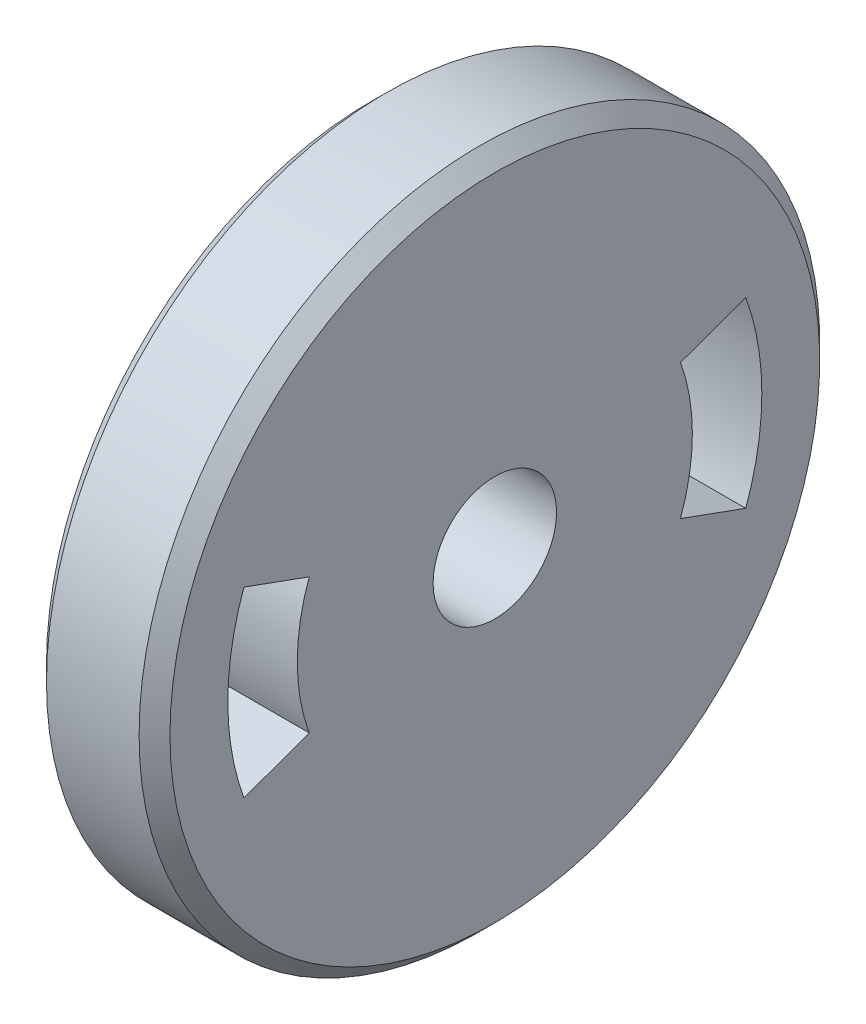
from build123d import *

# Parameters (mm, degrees)
SKETCH1_R           = 22.05
BOSS_EXTRUDE1_DEPTH = 8
CUT_EXTRUDE1_REACH  = 54.573
SKETCH2_R           = 4
CUT_EXTRUDE2_REACH  = 54.573
FILLET1_SIZE        = 1
BOSS_EXTRUDE2_START = 6
SKETCH4_W           = 14
SKETCH4_H           = 20
SKETCH4_R           = 4
BOSS_EXTRUDE2_DEPTH = 6
SKETCH6_W           = 12.1
SKETCH6_H           = 8.1
CUT_EXTRUDE3_DEPTH  = 2
SKETCH7_R           = 1.25
CUT_EXTRUDE4_DEPTH  = 8
FILLET2_R           = 1


with BuildPart() as part:
    # Sketch1 → Boss-Extrude1 (new body)
    with BuildSketch(Plane.ZY):
        with Locations((25, 0)):
            Circle(SKETCH1_R)
    extrude(amount=BOSS_EXTRUDE1_DEPTH)

    # Sketch2 → Cut-Extrude1 (cut, up to next)
    with BuildSketch(Plane.ZY.offset(8), mode=Mode.PRIVATE) as cut_extrude1_sk1:
        with Locations((25, 0)):
            Circle(SKETCH2_R)
    cut_extrude1_tool1 = extrude(cut_extrude1_sk1.sketch, amount=-CUT_EXTRUDE1_REACH, mode=Mode.PRIVATE) & part.part
    add(cut_extrude1_tool1.solids().sort_by_distance((-8, 0, 25))[0], mode=Mode.SUBTRACT)

    # Sketch3 → Cut-Extrude2 (cut, up to next)
    with BuildSketch(Plane.ZY.offset(8), mode=Mode.PRIVATE) as cut_extrude2_sk1:
        with BuildLine():
            Line((12.972134752, -4.377784932), (8.743517959, -5.916875577))
            ThreePointArc((8.743517959, -5.916875577), (7.700213153, 0), (8.743517959, 5.916875577))
            Line((8.743517959, 5.916875577), (12.972134752, 4.377784932))
            ThreePointArc((12.972134752, 4.377784932), (12.200213153, 0), (12.972134752, -4.377784932))
        make_face()
    cut_extrude2_tool1 = extrude(cut_extrude2_sk1.sketch, amount=-CUT_EXTRUDE2_REACH, mode=Mode.PRIVATE) & part.part
    # Sketch3 → Cut-Extrude2 (cut, up to next)
    with BuildSketch(Plane.ZY.offset(8), mode=Mode.PRIVATE) as cut_extrude2_sk2:
        with BuildLine():
            Line((37.027865248, -4.377784932), (41.256482041, -5.916875577))
            ThreePointArc((41.256482041, -5.916875577), (42.299786847, 0), (41.256482041, 5.916875577))
            Line((41.256482041, 5.916875577), (37.027865248, 4.377784932))
            ThreePointArc((37.027865248, 4.377784932), (37.799786847, 0), (37.027865248, -4.377784932))
        make_face()
    cut_extrude2_tool2 = extrude(cut_extrude2_sk2.sketch, amount=-CUT_EXTRUDE2_REACH, mode=Mode.PRIVATE) & part.part
    add(cut_extrude2_tool1.solids().sort_by_distance((-8, 0, 10.14412))[0], mode=Mode.SUBTRACT)
    add(cut_extrude2_tool2.solids().sort_by_distance((-8, 0, 39.85588))[0], mode=Mode.SUBTRACT)

    # Fillet1
    fillet1_edges = [part.edges().sort_by_distance(p)[0] for p in [
        (0, 0, 2.95),
        (-8, 0, 2.95),
    ]]
    chamfer(fillet1_edges, length=FILLET1_SIZE)

    # Sketch4 → Boss-Extrude2 (add)
    with BuildSketch(Plane.ZY.offset(8).offset(BOSS_EXTRUDE2_START)):
        with Locations((25, -1.3)):
            Rectangle(SKETCH4_W, SKETCH4_H)
        with Locations((25, 0)):
            Circle(SKETCH4_R, mode=Mode.SUBTRACT)
    extrude(amount=-BOSS_EXTRUDE2_DEPTH)

    # Sketch6 → Cut-Extrude3 (cut)
    with BuildSketch(Plane.ZY.offset(14)):
        with Locations((25, -1.3)):
            Rectangle(SKETCH6_W, SKETCH6_H)
    extrude(amount=-CUT_EXTRUDE3_DEPTH, mode=Mode.SUBTRACT)

    # Sketch7 → Cut-Extrude4 (cut)
    with BuildSketch(Plane.ZY.offset(14)):
        with Locations((25, 5.95)):
            Circle(SKETCH7_R)
        with Locations((25, -8.55)):
            Circle(SKETCH7_R)
    extrude(amount=-CUT_EXTRUDE4_DEPTH, mode=Mode.SUBTRACT)

    # Fillet2
    fillet2_edges = [part.edges().sort_by_distance(p)[0] for p in [
        (-8, -11.3, 25),
        (-8, -1.3, 32),
        (-8, 8.7, 25),
        (-8, -1.3, 18),
    ]]
    fillet(fillet2_edges, radius=FILLET2_R)


solid = part.part
